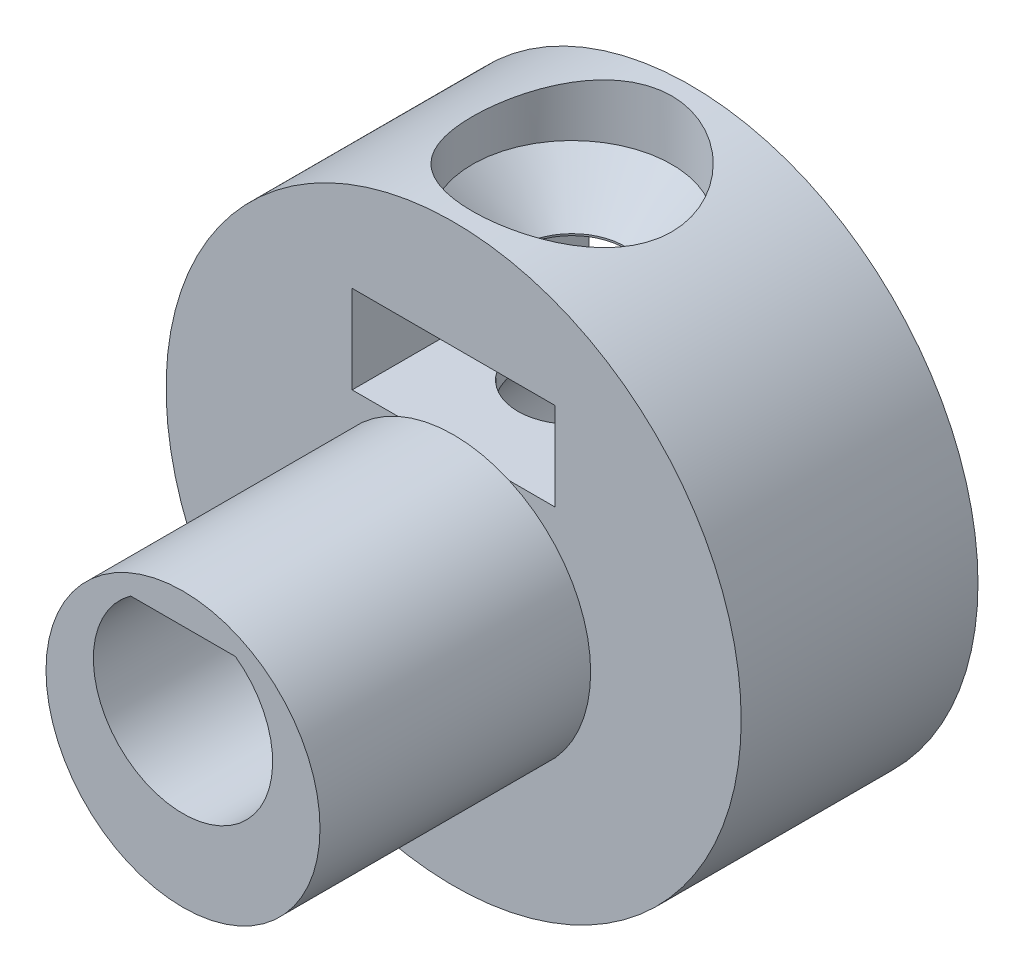
from build123d import *

# Parameters (mm, degrees)
ESQUISSE1_R             = 8.5
BOSS_EXTRU_1_DEPTH      = 7
ESQUISSE2_W             = 6
ESQUISSE2_H             = 2.6
ENL_V_MAT_EXTRU_1_DEPTH = 14.910427743
ESQUISSE7_R             = 2.95
ENL_V_MAT_EXTRU_8_DEPTH = 21.087060672
ESQUISSE9_R             = 4.05
BOSS_EXTRU_2_DEPTH      = 8
ENL_V_MAT_EXTRU_9_DEPTH = 20.222382876


with BuildPart() as part:
    # Esquisse1 → Boss.-Extru.1 (new body)
    with BuildSketch(Plane.XY):
        Circle(ESQUISSE1_R)
    extrude(amount=BOSS_EXTRU_1_DEPTH)

    # Esquisse2 → Enlèv. mat.-Extru.1 (cut, through all)
    with BuildSketch(Plane(origin=(0, 0, 0), x_dir=(-1, 0, 0), z_dir=(0, 0, -1))):
        with Locations((0, 4)):
            Rectangle(ESQUISSE2_W, ESQUISSE2_H)
    extrude(amount=-ENL_V_MAT_EXTRU_1_DEPTH, mode=Mode.SUBTRACT)

    # Enlèv. mat.-Extru.2: read off the stored shape, not the designer's step
    # Enlèv. mat.-Extru.2 outline → Enlèv. mat.-Extru.2 (revolve, cut)
    with BuildSketch(Plane.XY.offset(3.5)):
        Polygon((0, 5.3), (1.554616831, 5.3), (1.498760014, 8.500034923), (0, 8.500034923), align=None)
        Polygon((1.6, 2.7), (0, 2.7), (0, 0.7), (1.56508987, 0.7), align=None)
    revolve(axis=Axis((0, 0, 3.5), (0, 1, 0)), mode=Mode.SUBTRACT)

    # Esquisse7 → Enlèv. mat.-Extru.8 (cut, through all)
    with BuildSketch(Plane(origin=(0, 8.3, 0), x_dir=(1, 0, 0), z_dir=(0, 1, 0))):
        with Locations((0, -3.5)):
            Circle(ESQUISSE7_R)
    extrude(amount=ENL_V_MAT_EXTRU_8_DEPTH, mode=Mode.SUBTRACT)

    # Chanfrein1: read off the stored shape, not the designer's step
    # Chanfrein1 outline → Chanfrein1 (revolve, cut)
    with BuildSketch(Plane.XY.offset(3.5)):
        Polygon((2.95, 6.747748364), (2.95, 8.3), (1.502251636, 8.3), (1.553718474, 5.351466838), align=None)
    revolve(axis=Axis((0, 0, 3.5), (0, 1, 0)), mode=Mode.SUBTRACT)

    # Esquisse9 → Boss.-Extru.2 (add)
    with BuildSketch(Plane.XY.offset(7)):
        with Locations(Location((0, -1, 0), (0, 0, 113.995098868))):
            Circle(ESQUISSE9_R)
    extrude(amount=BOSS_EXTRU_2_DEPTH)

    # Esquisse10 → Enlèv. mat.-Extru.9 (cut, through all)
    with BuildSketch(Plane(origin=(0, 0, 0), x_dir=(-1, 0, 0), z_dir=(0, 0, -1))):
        with BuildLine():
            Line((-1.549193338, 2.15), (1.549193338, 2.15))
            ThreePointArc((1.549193338, 2.15), (0, -2.65), (-1.549193338, 2.15))
        make_face()
    extrude(amount=-ENL_V_MAT_EXTRU_9_DEPTH, mode=Mode.SUBTRACT)


solid = part.part
